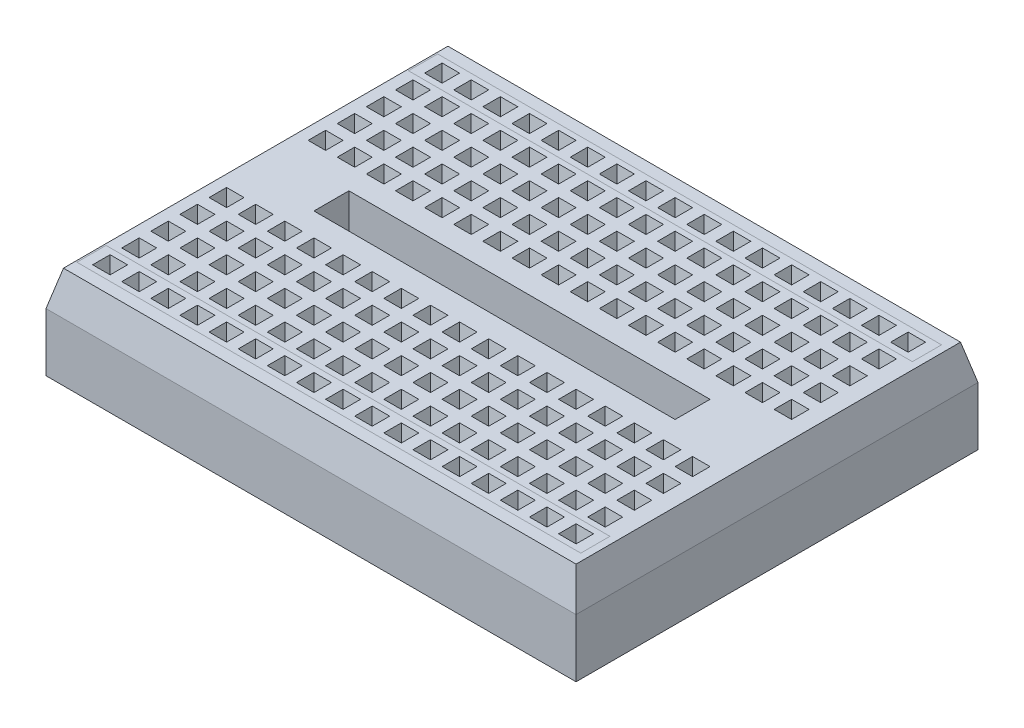
from build123d import *

# Parameters (mm, degrees)
SKETCH1_W            = 45.5
SKETCH1_H            = 34.5
BOSS_EXTRUDE1_DEPTH  = 5
SKETCH5_W            = 31
SKETCH5_H            = 3
CUT_EXTRUDE1_DEPTH   = 3
LPATTERN1_COUNT      = 17
LPATTERN1_PITCH      = 2.5
LPATTERN1_COUNT_DIR2 = 5
LPATTERN1_PITCH_DIR2 = 2.5


# Read off the part's stored shape, not the designer's step: Mirror1
with BuildPart() as part:
    # Sketch1 → Boss-Extrude1 (new body)
    with BuildSketch(Plane(origin=(0, 0, 0), x_dir=(1, 0, 0), z_dir=(0, 1, 0))):
        Rectangle(SKETCH1_W, SKETCH1_H)
    extrude(amount=BOSS_EXTRUDE1_DEPTH)

    # Sketch3 → Loft1 section 0
    with BuildSketch(Plane(origin=(0, 8, 0), x_dir=(1, 0, 0), z_dir=(0, 1, 0))):
        with BuildLine():
            Line((-22, -16.5), (22, -16.5))
            Line((22, -16.5), (22, 16.5))
            Line((22, 16.5), (-22, 16.5))
            Line((-22, 16.5), (-22, -16.5))
        make_face()
    # Sketch4 → Loft1 section 1
    with BuildSketch(Plane(origin=(0, 5, 0), x_dir=(1, 0, 0), z_dir=(0, 1, 0))):
        with BuildLine():
            Line((22.75, -17.25), (22.75, 17.25))
            Line((22.75, 17.25), (-22.75, 17.25))
            Line((-22.75, 17.25), (-22.75, -17.25))
            Line((-22.75, -17.25), (22.75, -17.25))
        make_face()
    loft()

    # Sketch5 → Cut-Extrude1 (cut)
    with BuildSketch(Plane(origin=(0, 8, 0), x_dir=(1, 0, 0), z_dir=(0, 1, 0))):
        Rectangle(SKETCH5_W, SKETCH5_H)
    extrude(amount=-CUT_EXTRUDE1_DEPTH, mode=Mode.SUBTRACT)

    # Sketch7 → Cut-Loft1 section 0
    with BuildSketch(Plane(origin=(0, 6.5, 0), x_dir=(1, 0, 0), z_dir=(0, 1, 0))):
        with BuildLine():
            Line((-19.75, -13.75), (-20.75, -13.75))
            Line((-20.75, -13.75), (-20.75, -14.75))
            Line((-20.75, -14.75), (-19.75, -14.75))
            Line((-19.75, -14.75), (-19.75, -13.75))
        make_face()
    # Sketch6 → Cut-Loft1 section 1
    with BuildSketch(Plane(origin=(0, 8, 0), x_dir=(1, 0, 0), z_dir=(0, 1, 0))):
        with BuildLine():
            Line((-21, -13.5), (-19.5, -13.5))
            Line((-19.5, -13.5), (-19.5, -15))
            Line((-19.5, -15), (-21, -15))
            Line((-21, -15), (-21, -13.5))
        make_face()
    cut_loft1 = loft(mode=Mode.SUBTRACT)

    # LPattern1: Cut-Loft1 17 × 5
    with Locations(*[(i * LPATTERN1_PITCH, 0, -j * LPATTERN1_PITCH_DIR2) for i in range(LPATTERN1_COUNT) for j in range(LPATTERN1_COUNT_DIR2) if (i, j) != (0, 0)]):
        add(cut_loft1, mode=Mode.SUBTRACT)

    # Mirror1
    split(bisect_by=Plane.XY, keep=Keep.TOP)

    # Mirror1 2: part across plane


with BuildPart() as part_1:
    add(part.part)
    add(part.part.mirror(Plane.XY))


solid = part_1.part
